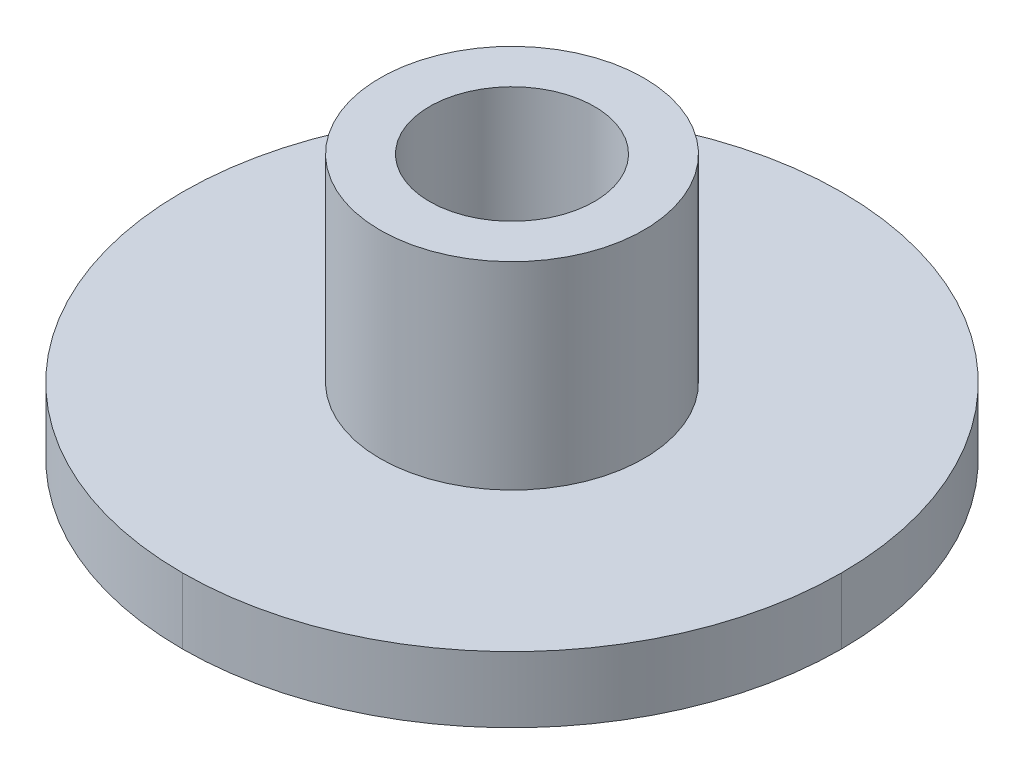
from build123d import *

# Parameters (mm, degrees)
SKETCH_1_W      = 40
SKETCH_1_H      = 40
EXTRUDE_1_DEPTH = 4
SKETCH_2_R      = 8
SKETCH_2_R_2    = 5
EXTRUDE_2_DEPTH = 12
FILLET_1_R      = 20


with BuildPart() as part:
    # Эскиз1 → Вытянуть1 (new body)
    with BuildSketch(Plane(origin=(0, 0, 0), x_dir=(1, 0, 0), z_dir=(0, 1, 0))):
        with Locations((20, 20)):
            Rectangle(SKETCH_1_W, SKETCH_1_H)
    extrude(amount=EXTRUDE_1_DEPTH)

    # Эскиз2 → Вытянуть2 (add)
    with BuildSketch(Plane(origin=(0, 4, 0), x_dir=(1, 0, 0), z_dir=(0, 1, 0))):
        with Locations(Location((20, 20, 0), (0, 0, 90))):
            Circle(SKETCH_2_R)
        with Locations(Location((20, 20, 0), (0, 0, 270))):
            Circle(SKETCH_2_R_2, mode=Mode.SUBTRACT)
    extrude(amount=EXTRUDE_2_DEPTH)

    # Скругление1
    fillet_1_edges = [part.edges().sort_by_distance(p)[0] for p in [
        (40, 2, 0),
        (0, 2, 0),
        (0, 2, -40),
        (40, 2, -40),
    ]]
    fillet(fillet_1_edges, radius=FILLET_1_R - 0.0001)  # a hair under: the kernel refuses the full size


solid = part.part
